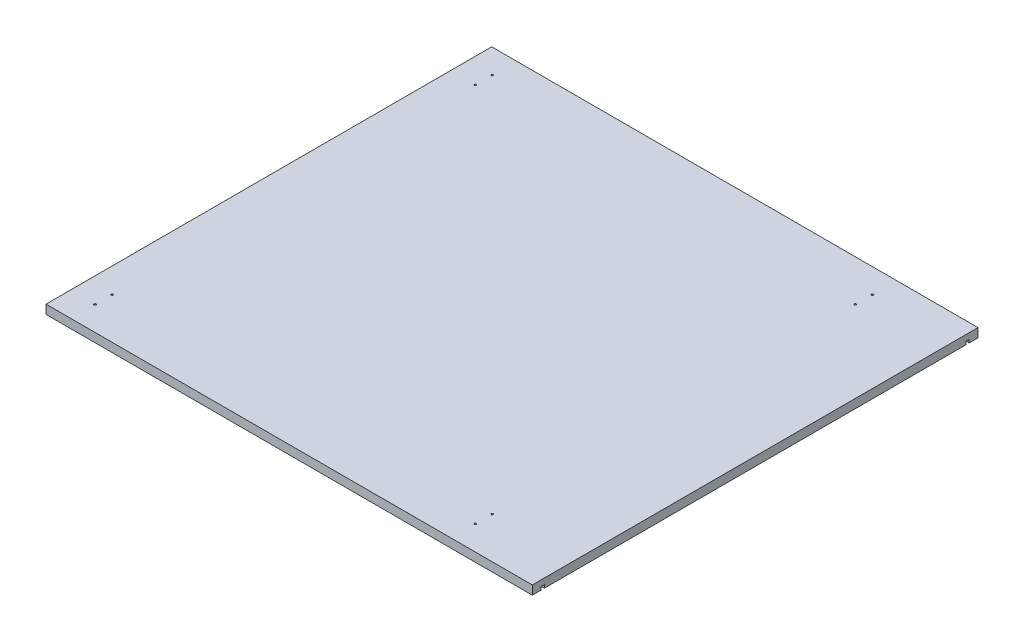
from build123d import *

# Parameters (mm, degrees)
SKETCH1_W           = 997.712
SKETCH1_H           = 914.4
BOSS_EXTRUDE1_DEPTH = 18.25625
SKETCH2_R           = 2
CUT_EXTRUDE1_DEPTH  = 50.8
CUT_EXTRUDE3_DEPTH  = 6.35


with BuildPart() as part:
    # Sketch1 → Boss-Extrude1 (new body)
    with BuildSketch(Plane(origin=(0, 0, 0), x_dir=(1, 0, 0), z_dir=(0, 1, 0))):
        Rectangle(SKETCH1_W, SKETCH1_H)
    extrude(amount=BOSS_EXTRUDE1_DEPTH)

    # Sketch2 → Cut-Extrude1 (cut)
    with BuildSketch(Plane(origin=(0, 18.25625, 0), x_dir=(1, 0, 0), z_dir=(0, 1, 0))):
        with Locations((-448.056, 407.5)):
            Circle(SKETCH2_R)
        with Locations((-448.056, 372.5)):
            Circle(SKETCH2_R)
        with Locations((331.944, 372.5)):
            Circle(SKETCH2_R)
        with Locations((331.944, 407.5)):
            Circle(SKETCH2_R)
        with Locations((-448.056, -372.5)):
            Circle(SKETCH2_R)
        with Locations((-448.056, -407.5)):
            Circle(SKETCH2_R)
        with Locations((331.944, -372.5)):
            Circle(SKETCH2_R)
        with Locations((331.944, -407.5)):
            Circle(SKETCH2_R)
    extrude(amount=-CUT_EXTRUDE1_DEPTH, mode=Mode.SUBTRACT)

    # Sketch4 → Cut-Extrude3 (cut)
    with BuildSketch(Plane.XZ):
        Polygon((-480.59975, -438.94375), (498.856, -438.94375), (498.856, -432.59375), (-474.24975, -432.59375), (-474.24975, 432.59375), (498.856, 432.59375), (498.856, 438.94375), (-480.59975, 438.94375), align=None)
    extrude(amount=-CUT_EXTRUDE3_DEPTH, mode=Mode.SUBTRACT)


solid = part.part
